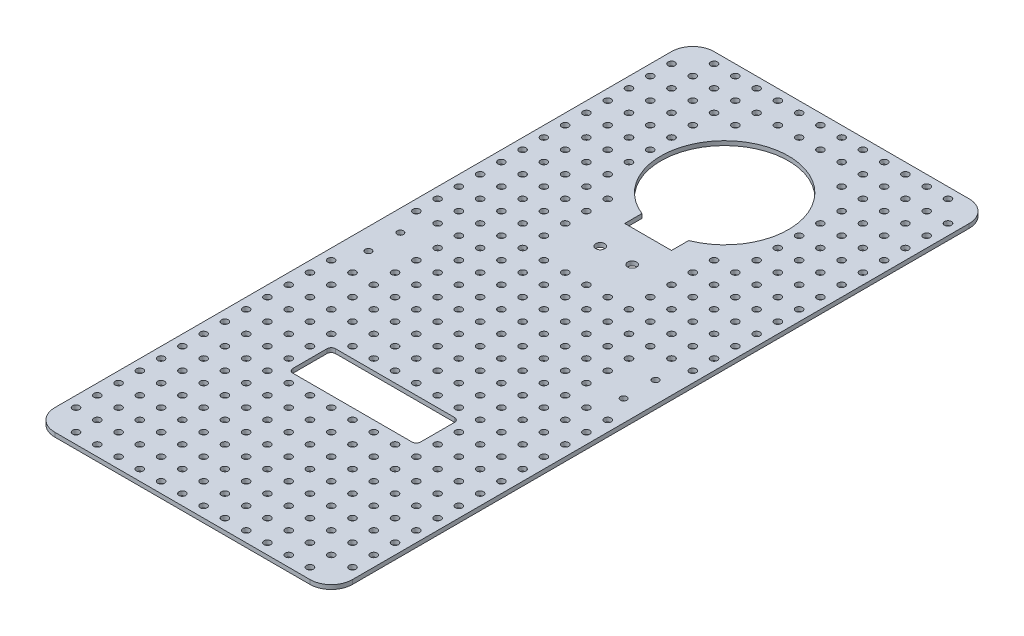
from build123d import *

# Parameters (mm, degrees)
SKETCH_1_W             = 140
SKETCH_1_H             = 310
EXTRUDE_554_DEPTH      = 2
SKETCH_12_R            = 1.5
CUT_EXTRUDE_1045_DEPTH = 171.085272731
SKETCH_11_W            = 60
SKETCH_11_H            = 20
CUT_EXTRUDE_2174_DEPTH = 171.085272731
FILLET_3_R             = 2
SKETCH_18_R            = 2.1
CUT_EXTRUDE_8002_DEPTH = 171.085272731
FILLET_9_R             = 10
SKETCH_20_R            = 1.6
CUT_EXTRUDE_10_DEPTH   = 2


with BuildPart() as part:
    # Эскиз1 → Extrude 554 (new body)
    with BuildSketch(Plane(origin=(0, 0, 0), x_dir=(1, 0, 0), z_dir=(0, 1, 0))):
        Rectangle(SKETCH_1_W, SKETCH_1_H)
    extrude(amount=EXTRUDE_554_DEPTH)

    # Эскиз12 → Cut-Extrude 1045 (cut, through all)
    with BuildSketch(Plane(origin=(0, 2, 0), x_dir=(1, 0, 0), z_dir=(0, 1, 0))):
        with Locations(Location((60, 7.5, 0), (0, 0, 270))):
            Circle(SKETCH_12_R)
        with Locations(Location((-60, 7.5, 0), (0, 0, 270))):
            Circle(SKETCH_12_R)
        with Locations(Location((-60, -7.5, 0), (0, 0, 270))):
            Circle(SKETCH_12_R)
        with Locations(Location((60, -7.5, 0), (0, 0, 270))):
            Circle(SKETCH_12_R)
    extrude(amount=-CUT_EXTRUDE_1045_DEPTH, mode=Mode.SUBTRACT)

    # Эскиз11 → Cut-Extrude 2174 (cut, through all)
    with BuildSketch(Plane(origin=(0, 2, 0), x_dir=(1, 0, 0), z_dir=(0, 1, 0))):
        with Locations((0, -65)):
            Rectangle(SKETCH_11_W, SKETCH_11_H)
    extrude(amount=-CUT_EXTRUDE_2174_DEPTH, mode=Mode.SUBTRACT)

    # Скругление3
    fillet_3_edges = [part.edges().sort_by_distance(p)[0] for p in [
        (-30, 1, 75),
        (-30, 1, 55),
        (30, 1, 55),
        (30, 1, 75),
    ]]
    fillet(fillet_3_edges, radius=FILLET_3_R)

    # Эскиз18 → Cut-Extrude 8002 (cut, through all)
    with BuildSketch(Plane(origin=(0, 2, 0), x_dir=(1, 0, 0), z_dir=(0, 1, 0))):
        with Locations(Location((7.5, 49, 0), (0, 0, 270))):
            Circle(SKETCH_18_R)
        with Locations(Location((-7.5, 49, 0), (0, 0, 270))):
            Circle(SKETCH_18_R)
        with BuildLine():
            Line((-11, 64), (11, 64))
            Line((11, 64), (11, 72.089428526))
            ThreePointArc((11, 72.089428526), (0, 130), (-11, 72.089428526))
            Line((-11, 72.089428526), (-11, 64))
        make_face()
    extrude(amount=-CUT_EXTRUDE_8002_DEPTH, mode=Mode.SUBTRACT)

    # Скругление9
    fillet_9_edges = [part.edges().sort_by_distance(p)[0] for p in [
        (-70, 1, -155),
        (70, 1, -155),
        (70, 1, 155),
        (-70, 1, 155),
    ]]
    fillet(fillet_9_edges, radius=FILLET_9_R)

    # Эскиз20 → Сетка 10мм (cut)
    with BuildSketch(Plane.XZ):
        with Locations(Location((-5, 150, 0), (0, 0, 270))):
            Circle(SKETCH_20_R)
        with Locations(Location((5, 150, 0), (0, 0, 270))):
            Circle(SKETCH_20_R)
        with Locations(Location((15, 150, 0), (0, 0, 270))):
            Circle(SKETCH_20_R)
        with Locations(Location((25, 150, 0), (0, 0, 270))):
            Circle(SKETCH_20_R)
        with Locations(Location((35, 150, 0), (0, 0, 270))):
            Circle(SKETCH_20_R)
        with Locations(Location((45, 150, 0), (0, 0, 270))):
            Circle(SKETCH_20_R)
        with Locations(Location((55, 150, 0), (0, 0, 270))):
            Circle(SKETCH_20_R)
        with Locations(Location((-15, 150, 0), (0, 0, 270))):
            Circle(SKETCH_20_R)
        with Locations(Location((-25, 150, 0), (0, 0, 270))):
            Circle(SKETCH_20_R)
        with Locations(Location((-35, 150, 0), (0, 0, 270))):
            Circle(SKETCH_20_R)
        with Locations(Location((-45, 150, 0), (0, 0, 270))):
            Circle(SKETCH_20_R)
        with Locations(Location((-55, 150, 0), (0, 0, 270))):
            Circle(SKETCH_20_R)
        with Locations(Location((-5, 140, 0), (0, 0, 270))):
            Circle(SKETCH_20_R)
        with Locations(Location((5, 140, 0), (0, 0, 270))):
            Circle(SKETCH_20_R)
        with Locations(Location((15, 140, 0), (0, 0, 270))):
            Circle(SKETCH_20_R)
        with Locations(Location((25, 140, 0), (0, 0, 270))):
            Circle(SKETCH_20_R)
        with Locations(Location((35, 140, 0), (0, 0, 270))):
            Circle(SKETCH_20_R)
        with Locations(Location((45, 140, 0), (0, 0, 270))):
            Circle(SKETCH_20_R)
        with Locations(Location((55, 140, 0), (0, 0, 270))):
            Circle(SKETCH_20_R)
        with Locations(Location((-15, 140, 0), (0, 0, 270))):
            Circle(SKETCH_20_R)
        with Locations(Location((-25, 140, 0), (0, 0, 270))):
            Circle(SKETCH_20_R)
        with Locations(Location((-35, 140, 0), (0, 0, 270))):
            Circle(SKETCH_20_R)
        with Locations(Location((-45, 140, 0), (0, 0, 270))):
            Circle(SKETCH_20_R)
        with Locations(Location((-55, 140, 0), (0, 0, 270))):
            Circle(SKETCH_20_R)
        with Locations(Location((-5, 130, 0), (0, 0, 270))):
            Circle(SKETCH_20_R)
        with Locations(Location((5, 130, 0), (0, 0, 270))):
            Circle(SKETCH_20_R)
        with Locations(Location((15, 130, 0), (0, 0, 270))):
            Circle(SKETCH_20_R)
        with Locations(Location((25, 130, 0), (0, 0, 270))):
            Circle(SKETCH_20_R)
        with Locations(Location((35, 130, 0), (0, 0, 270))):
            Circle(SKETCH_20_R)
        with Locations(Location((45, 130, 0), (0, 0, 270))):
            Circle(SKETCH_20_R)
        with Locations(Location((55, 130, 0), (0, 0, 270))):
            Circle(SKETCH_20_R)
        with Locations(Location((-15, 130, 0), (0, 0, 270))):
            Circle(SKETCH_20_R)
        with Locations(Location((-25, 130, 0), (0, 0, 270))):
            Circle(SKETCH_20_R)
        with Locations(Location((-35, 130, 0), (0, 0, 270))):
            Circle(SKETCH_20_R)
        with Locations(Location((-45, 130, 0), (0, 0, 270))):
            Circle(SKETCH_20_R)
        with Locations(Location((-55, 130, 0), (0, 0, 270))):
            Circle(SKETCH_20_R)
        with Locations(Location((-5, 120, 0), (0, 0, 270))):
            Circle(SKETCH_20_R)
        with Locations(Location((5, 120, 0), (0, 0, 270))):
            Circle(SKETCH_20_R)
        with Locations(Location((15, 120, 0), (0, 0, 270))):
            Circle(SKETCH_20_R)
        with Locations(Location((25, 120, 0), (0, 0, 270))):
            Circle(SKETCH_20_R)
        with Locations(Location((35, 120, 0), (0, 0, 270))):
            Circle(SKETCH_20_R)
        with Locations(Location((45, 120, 0), (0, 0, 270))):
            Circle(SKETCH_20_R)
        with Locations(Location((55, 120, 0), (0, 0, 270))):
            Circle(SKETCH_20_R)
        with Locations(Location((-15, 120, 0), (0, 0, 270))):
            Circle(SKETCH_20_R)
        with Locations(Location((-25, 120, 0), (0, 0, 270))):
            Circle(SKETCH_20_R)
        with Locations(Location((-35, 120, 0), (0, 0, 270))):
            Circle(SKETCH_20_R)
        with Locations(Location((-45, 120, 0), (0, 0, 270))):
            Circle(SKETCH_20_R)
        with Locations(Location((-55, 120, 0), (0, 0, 270))):
            Circle(SKETCH_20_R)
        with Locations(Location((-5, 110, 0), (0, 0, 270))):
            Circle(SKETCH_20_R)
        with Locations(Location((5, 110, 0), (0, 0, 270))):
            Circle(SKETCH_20_R)
        with Locations(Location((15, 110, 0), (0, 0, 270))):
            Circle(SKETCH_20_R)
        with Locations(Location((25, 110, 0), (0, 0, 270))):
            Circle(SKETCH_20_R)
        with Locations(Location((35, 110, 0), (0, 0, 270))):
            Circle(SKETCH_20_R)
        with Locations(Location((45, 110, 0), (0, 0, 270))):
            Circle(SKETCH_20_R)
        with Locations(Location((55, 110, 0), (0, 0, 270))):
            Circle(SKETCH_20_R)
        with Locations(Location((-15, 110, 0), (0, 0, 270))):
            Circle(SKETCH_20_R)
        with Locations(Location((-25, 110, 0), (0, 0, 270))):
            Circle(SKETCH_20_R)
        with Locations(Location((-35, 110, 0), (0, 0, 270))):
            Circle(SKETCH_20_R)
        with Locations(Location((-45, 110, 0), (0, 0, 270))):
            Circle(SKETCH_20_R)
        with Locations(Location((-55, 110, 0), (0, 0, 270))):
            Circle(SKETCH_20_R)
        with Locations(Location((-5, 100, 0), (0, 0, 270))):
            Circle(SKETCH_20_R)
        with Locations(Location((5, 100, 0), (0, 0, 270))):
            Circle(SKETCH_20_R)
        with Locations(Location((15, 100, 0), (0, 0, 270))):
            Circle(SKETCH_20_R)
        with Locations(Location((25, 100, 0), (0, 0, 270))):
            Circle(SKETCH_20_R)
        with Locations(Location((35, 100, 0), (0, 0, 270))):
            Circle(SKETCH_20_R)
        with Locations(Location((45, 100, 0), (0, 0, 270))):
            Circle(SKETCH_20_R)
        with Locations(Location((55, 100, 0), (0, 0, 270))):
            Circle(SKETCH_20_R)
        with Locations(Location((-15, 100, 0), (0, 0, 270))):
            Circle(SKETCH_20_R)
        with Locations(Location((-25, 100, 0), (0, 0, 270))):
            Circle(SKETCH_20_R)
        with Locations(Location((-35, 100, 0), (0, 0, 270))):
            Circle(SKETCH_20_R)
        with Locations(Location((-45, 100, 0), (0, 0, 270))):
            Circle(SKETCH_20_R)
        with Locations(Location((-55, 100, 0), (0, 0, 270))):
            Circle(SKETCH_20_R)
        with Locations(Location((-5, 90, 0), (0, 0, 270))):
            Circle(SKETCH_20_R)
        with Locations(Location((5, 90, 0), (0, 0, 270))):
            Circle(SKETCH_20_R)
        with Locations(Location((15, 90, 0), (0, 0, 270))):
            Circle(SKETCH_20_R)
        with Locations(Location((25, 90, 0), (0, 0, 270))):
            Circle(SKETCH_20_R)
        with Locations(Location((35, 90, 0), (0, 0, 270))):
            Circle(SKETCH_20_R)
        with Locations(Location((45, 90, 0), (0, 0, 270))):
            Circle(SKETCH_20_R)
        with Locations(Location((55, 90, 0), (0, 0, 270))):
            Circle(SKETCH_20_R)
        with Locations(Location((-15, 90, 0), (0, 0, 270))):
            Circle(SKETCH_20_R)
        with Locations(Location((-25, 90, 0), (0, 0, 270))):
            Circle(SKETCH_20_R)
        with Locations(Location((-35, 90, 0), (0, 0, 270))):
            Circle(SKETCH_20_R)
        with Locations(Location((-45, 90, 0), (0, 0, 270))):
            Circle(SKETCH_20_R)
        with Locations(Location((-55, 90, 0), (0, 0, 270))):
            Circle(SKETCH_20_R)
        with Locations(Location((-5, 80, 0), (0, 0, 270))):
            Circle(SKETCH_20_R)
        with Locations(Location((5, 80, 0), (0, 0, 270))):
            Circle(SKETCH_20_R)
        with Locations(Location((15, 80, 0), (0, 0, 270))):
            Circle(SKETCH_20_R)
        with Locations(Location((25, 80, 0), (0, 0, 270))):
            Circle(SKETCH_20_R)
        with Locations(Location((35, 80, 0), (0, 0, 270))):
            Circle(SKETCH_20_R)
        with Locations(Location((45, 80, 0), (0, 0, 270))):
            Circle(SKETCH_20_R)
        with Locations(Location((55, 80, 0), (0, 0, 270))):
            Circle(SKETCH_20_R)
        with Locations(Location((-15, 80, 0), (0, 0, 270))):
            Circle(SKETCH_20_R)
        with Locations(Location((-25, 80, 0), (0, 0, 270))):
            Circle(SKETCH_20_R)
        with Locations(Location((-35, 80, 0), (0, 0, 270))):
            Circle(SKETCH_20_R)
        with Locations(Location((-45, 80, 0), (0, 0, 270))):
            Circle(SKETCH_20_R)
        with Locations(Location((-55, 80, 0), (0, 0, 270))):
            Circle(SKETCH_20_R)
        with Locations(Location((35, 70, 0), (0, 0, 270))):
            Circle(SKETCH_20_R)
        with Locations(Location((45, 70, 0), (0, 0, 270))):
            Circle(SKETCH_20_R)
        with Locations(Location((55, 70, 0), (0, 0, 270))):
            Circle(SKETCH_20_R)
        with Locations(Location((-35, 70, 0), (0, 0, 270))):
            Circle(SKETCH_20_R)
        with Locations(Location((-45, 70, 0), (0, 0, 270))):
            Circle(SKETCH_20_R)
        with Locations(Location((-55, 70, 0), (0, 0, 270))):
            Circle(SKETCH_20_R)
        with Locations(Location((35, 60, 0), (0, 0, 270))):
            Circle(SKETCH_20_R)
        with Locations(Location((45, 60, 0), (0, 0, 270))):
            Circle(SKETCH_20_R)
        with Locations(Location((55, 60, 0), (0, 0, 270))):
            Circle(SKETCH_20_R)
        with Locations(Location((-35, 60, 0), (0, 0, 270))):
            Circle(SKETCH_20_R)
        with Locations(Location((-45, 60, 0), (0, 0, 270))):
            Circle(SKETCH_20_R)
        with Locations(Location((-55, 60, 0), (0, 0, 270))):
            Circle(SKETCH_20_R)
        with Locations(Location((-5, 50, 0), (0, 0, 270))):
            Circle(SKETCH_20_R)
        with Locations(Location((5, 50, 0), (0, 0, 270))):
            Circle(SKETCH_20_R)
        with Locations(Location((15, 50, 0), (0, 0, 270))):
            Circle(SKETCH_20_R)
        with Locations(Location((25, 50, 0), (0, 0, 270))):
            Circle(SKETCH_20_R)
        with Locations(Location((35, 50, 0), (0, 0, 270))):
            Circle(SKETCH_20_R)
        with Locations(Location((45, 50, 0), (0, 0, 270))):
            Circle(SKETCH_20_R)
        with Locations(Location((55, 50, 0), (0, 0, 270))):
            Circle(SKETCH_20_R)
        with Locations(Location((-15, 50, 0), (0, 0, 270))):
            Circle(SKETCH_20_R)
        with Locations(Location((-25, 50, 0), (0, 0, 270))):
            Circle(SKETCH_20_R)
        with Locations(Location((-35, 50, 0), (0, 0, 270))):
            Circle(SKETCH_20_R)
        with Locations(Location((-45, 50, 0), (0, 0, 270))):
            Circle(SKETCH_20_R)
        with Locations(Location((-55, 50, 0), (0, 0, 270))):
            Circle(SKETCH_20_R)
        with Locations(Location((-5, 40, 0), (0, 0, 270))):
            Circle(SKETCH_20_R)
        with Locations(Location((5, 40, 0), (0, 0, 270))):
            Circle(SKETCH_20_R)
        with Locations(Location((15, 40, 0), (0, 0, 270))):
            Circle(SKETCH_20_R)
        with Locations(Location((25, 40, 0), (0, 0, 270))):
            Circle(SKETCH_20_R)
        with Locations(Location((35, 40, 0), (0, 0, 270))):
            Circle(SKETCH_20_R)
        with Locations(Location((45, 40, 0), (0, 0, 270))):
            Circle(SKETCH_20_R)
        with Locations(Location((55, 40, 0), (0, 0, 270))):
            Circle(SKETCH_20_R)
        with Locations(Location((-15, 40, 0), (0, 0, 270))):
            Circle(SKETCH_20_R)
        with Locations(Location((-25, 40, 0), (0, 0, 270))):
            Circle(SKETCH_20_R)
        with Locations(Location((-35, 40, 0), (0, 0, 270))):
            Circle(SKETCH_20_R)
        with Locations(Location((-45, 40, 0), (0, 0, 270))):
            Circle(SKETCH_20_R)
        with Locations(Location((-55, 40, 0), (0, 0, 270))):
            Circle(SKETCH_20_R)
        with Locations(Location((-5, 30, 0), (0, 0, 270))):
            Circle(SKETCH_20_R)
        with Locations(Location((5, 30, 0), (0, 0, 270))):
            Circle(SKETCH_20_R)
        with Locations(Location((15, 30, 0), (0, 0, 270))):
            Circle(SKETCH_20_R)
        with Locations(Location((25, 30, 0), (0, 0, 270))):
            Circle(SKETCH_20_R)
        with Locations(Location((35, 30, 0), (0, 0, 270))):
            Circle(SKETCH_20_R)
        with Locations(Location((45, 30, 0), (0, 0, 270))):
            Circle(SKETCH_20_R)
        with Locations(Location((55, 30, 0), (0, 0, 270))):
            Circle(SKETCH_20_R)
        with Locations(Location((-15, 30, 0), (0, 0, 270))):
            Circle(SKETCH_20_R)
        with Locations(Location((-25, 30, 0), (0, 0, 270))):
            Circle(SKETCH_20_R)
        with Locations(Location((-35, 30, 0), (0, 0, 270))):
            Circle(SKETCH_20_R)
        with Locations(Location((-45, 30, 0), (0, 0, 270))):
            Circle(SKETCH_20_R)
        with Locations(Location((-55, 30, 0), (0, 0, 270))):
            Circle(SKETCH_20_R)
        with Locations(Location((-5, 20, 0), (0, 0, 270))):
            Circle(SKETCH_20_R)
        with Locations(Location((5, 20, 0), (0, 0, 270))):
            Circle(SKETCH_20_R)
        with Locations(Location((15, 20, 0), (0, 0, 270))):
            Circle(SKETCH_20_R)
        with Locations(Location((25, 20, 0), (0, 0, 270))):
            Circle(SKETCH_20_R)
        with Locations(Location((35, 20, 0), (0, 0, 270))):
            Circle(SKETCH_20_R)
        with Locations(Location((45, 20, 0), (0, 0, 270))):
            Circle(SKETCH_20_R)
        with Locations(Location((55, 20, 0), (0, 0, 270))):
            Circle(SKETCH_20_R)
        with Locations(Location((-15, 20, 0), (0, 0, 270))):
            Circle(SKETCH_20_R)
        with Locations(Location((-25, 20, 0), (0, 0, 270))):
            Circle(SKETCH_20_R)
        with Locations(Location((-35, 20, 0), (0, 0, 270))):
            Circle(SKETCH_20_R)
        with Locations(Location((-45, 20, 0), (0, 0, 270))):
            Circle(SKETCH_20_R)
        with Locations(Location((-55, 20, 0), (0, 0, 270))):
            Circle(SKETCH_20_R)
        with Locations(Location((-5, 10, 0), (0, 0, 270))):
            Circle(SKETCH_20_R)
        with Locations(Location((5, 10, 0), (0, 0, 270))):
            Circle(SKETCH_20_R)
        with Locations(Location((15, 10, 0), (0, 0, 270))):
            Circle(SKETCH_20_R)
        with Locations(Location((25, 10, 0), (0, 0, 270))):
            Circle(SKETCH_20_R)
        with Locations(Location((35, 10, 0), (0, 0, 270))):
            Circle(SKETCH_20_R)
        with Locations(Location((45, 10, 0), (0, 0, 270))):
            Circle(SKETCH_20_R)
        with Locations(Location((-15, 10, 0), (0, 0, 270))):
            Circle(SKETCH_20_R)
        with Locations(Location((-25, 10, 0), (0, 0, 270))):
            Circle(SKETCH_20_R)
        with Locations(Location((-35, 10, 0), (0, 0, 270))):
            Circle(SKETCH_20_R)
        with Locations(Location((-45, 10, 0), (0, 0, 270))):
            Circle(SKETCH_20_R)
        with Locations(Location((-5, 0, 0), (0, 0, 270))):
            Circle(SKETCH_20_R)
        with Locations(Location((5, 0, 0), (0, 0, 270))):
            Circle(SKETCH_20_R)
        with Locations(Location((15, 0, 0), (0, 0, 270))):
            Circle(SKETCH_20_R)
        with Locations(Location((25, 0, 0), (0, 0, 270))):
            Circle(SKETCH_20_R)
        with Locations(Location((35, 0, 0), (0, 0, 270))):
            Circle(SKETCH_20_R)
        with Locations(Location((45, 0, 0), (0, 0, 270))):
            Circle(SKETCH_20_R)
        with Locations(Location((-15, 0, 0), (0, 0, 270))):
            Circle(SKETCH_20_R)
        with Locations(Location((-25, 0, 0), (0, 0, 270))):
            Circle(SKETCH_20_R)
        with Locations(Location((-35, 0, 0), (0, 0, 270))):
            Circle(SKETCH_20_R)
        with Locations(Location((-45, 0, 0), (0, 0, 270))):
            Circle(SKETCH_20_R)
        with Locations(Location((-5, -10, 0), (0, 0, 270))):
            Circle(SKETCH_20_R)
        with Locations(Location((5, -10, 0), (0, 0, 270))):
            Circle(SKETCH_20_R)
        with Locations(Location((15, -10, 0), (0, 0, 270))):
            Circle(SKETCH_20_R)
        with Locations(Location((25, -10, 0), (0, 0, 270))):
            Circle(SKETCH_20_R)
        with Locations(Location((35, -10, 0), (0, 0, 270))):
            Circle(SKETCH_20_R)
        with Locations(Location((45, -10, 0), (0, 0, 270))):
            Circle(SKETCH_20_R)
        with Locations(Location((-15, -10, 0), (0, 0, 270))):
            Circle(SKETCH_20_R)
        with Locations(Location((-25, -10, 0), (0, 0, 270))):
            Circle(SKETCH_20_R)
        with Locations(Location((-35, -10, 0), (0, 0, 270))):
            Circle(SKETCH_20_R)
        with Locations(Location((-45, -10, 0), (0, 0, 270))):
            Circle(SKETCH_20_R)
        with Locations(Location((-5, -20, 0), (0, 0, 270))):
            Circle(SKETCH_20_R)
        with Locations(Location((5, -20, 0), (0, 0, 270))):
            Circle(SKETCH_20_R)
        with Locations(Location((15, -20, 0), (0, 0, 270))):
            Circle(SKETCH_20_R)
        with Locations(Location((25, -20, 0), (0, 0, 270))):
            Circle(SKETCH_20_R)
        with Locations(Location((35, -20, 0), (0, 0, 270))):
            Circle(SKETCH_20_R)
        with Locations(Location((45, -20, 0), (0, 0, 270))):
            Circle(SKETCH_20_R)
        with Locations(Location((55, -20, 0), (0, 0, 270))):
            Circle(SKETCH_20_R)
        with Locations(Location((-15, -20, 0), (0, 0, 270))):
            Circle(SKETCH_20_R)
        with Locations(Location((-25, -20, 0), (0, 0, 270))):
            Circle(SKETCH_20_R)
        with Locations(Location((-35, -20, 0), (0, 0, 270))):
            Circle(SKETCH_20_R)
        with Locations(Location((-45, -20, 0), (0, 0, 270))):
            Circle(SKETCH_20_R)
        with Locations(Location((-55, -20, 0), (0, 0, 270))):
            Circle(SKETCH_20_R)
        with Locations(Location((-5, -30, 0), (0, 0, 270))):
            Circle(SKETCH_20_R)
        with Locations(Location((5, -30, 0), (0, 0, 270))):
            Circle(SKETCH_20_R)
        with Locations(Location((15, -30, 0), (0, 0, 270))):
            Circle(SKETCH_20_R)
        with Locations(Location((25, -30, 0), (0, 0, 270))):
            Circle(SKETCH_20_R)
        with Locations(Location((35, -30, 0), (0, 0, 270))):
            Circle(SKETCH_20_R)
        with Locations(Location((45, -30, 0), (0, 0, 270))):
            Circle(SKETCH_20_R)
        with Locations(Location((55, -30, 0), (0, 0, 270))):
            Circle(SKETCH_20_R)
        with Locations(Location((-15, -30, 0), (0, 0, 270))):
            Circle(SKETCH_20_R)
        with Locations(Location((-25, -30, 0), (0, 0, 270))):
            Circle(SKETCH_20_R)
        with Locations(Location((-35, -30, 0), (0, 0, 270))):
            Circle(SKETCH_20_R)
        with Locations(Location((-45, -30, 0), (0, 0, 270))):
            Circle(SKETCH_20_R)
        with Locations(Location((-55, -30, 0), (0, 0, 270))):
            Circle(SKETCH_20_R)
        with Locations(Location((25, -40, 0), (0, 0, 270))):
            Circle(SKETCH_20_R)
        with Locations(Location((35, -40, 0), (0, 0, 270))):
            Circle(SKETCH_20_R)
        with Locations(Location((45, -40, 0), (0, 0, 270))):
            Circle(SKETCH_20_R)
        with Locations(Location((55, -40, 0), (0, 0, 270))):
            Circle(SKETCH_20_R)
        with Locations(Location((-25, -40, 0), (0, 0, 270))):
            Circle(SKETCH_20_R)
        with Locations(Location((-35, -40, 0), (0, 0, 270))):
            Circle(SKETCH_20_R)
        with Locations(Location((-45, -40, 0), (0, 0, 270))):
            Circle(SKETCH_20_R)
        with Locations(Location((-55, -40, 0), (0, 0, 270))):
            Circle(SKETCH_20_R)
        with Locations(Location((25, -50, 0), (0, 0, 270))):
            Circle(SKETCH_20_R)
        with Locations(Location((35, -50, 0), (0, 0, 270))):
            Circle(SKETCH_20_R)
        with Locations(Location((45, -50, 0), (0, 0, 270))):
            Circle(SKETCH_20_R)
        with Locations(Location((55, -50, 0), (0, 0, 270))):
            Circle(SKETCH_20_R)
        with Locations(Location((-25, -50, 0), (0, 0, 270))):
            Circle(SKETCH_20_R)
        with Locations(Location((-35, -50, 0), (0, 0, 270))):
            Circle(SKETCH_20_R)
        with Locations(Location((-45, -50, 0), (0, 0, 270))):
            Circle(SKETCH_20_R)
        with Locations(Location((-55, -50, 0), (0, 0, 270))):
            Circle(SKETCH_20_R)
        with Locations(Location((25, -60, 0), (0, 0, 270))):
            Circle(SKETCH_20_R)
        with Locations(Location((35, -60, 0), (0, 0, 270))):
            Circle(SKETCH_20_R)
        with Locations(Location((45, -60, 0), (0, 0, 270))):
            Circle(SKETCH_20_R)
        with Locations(Location((55, -60, 0), (0, 0, 270))):
            Circle(SKETCH_20_R)
        with Locations(Location((-25, -60, 0), (0, 0, 270))):
            Circle(SKETCH_20_R)
        with Locations(Location((-35, -60, 0), (0, 0, 270))):
            Circle(SKETCH_20_R)
        with Locations(Location((-45, -60, 0), (0, 0, 270))):
            Circle(SKETCH_20_R)
        with Locations(Location((-55, -60, 0), (0, 0, 270))):
            Circle(SKETCH_20_R)
        with Locations(Location((25, -70, 0), (0, 0, 270))):
            Circle(SKETCH_20_R)
        with Locations(Location((35, -70, 0), (0, 0, 270))):
            Circle(SKETCH_20_R)
        with Locations(Location((45, -70, 0), (0, 0, 270))):
            Circle(SKETCH_20_R)
        with Locations(Location((55, -70, 0), (0, 0, 270))):
            Circle(SKETCH_20_R)
        with Locations(Location((-25, -70, 0), (0, 0, 270))):
            Circle(SKETCH_20_R)
        with Locations(Location((-35, -70, 0), (0, 0, 270))):
            Circle(SKETCH_20_R)
        with Locations(Location((-45, -70, 0), (0, 0, 270))):
            Circle(SKETCH_20_R)
        with Locations(Location((-55, -70, 0), (0, 0, 270))):
            Circle(SKETCH_20_R)
        with Locations(Location((35, -80, 0), (0, 0, 270))):
            Circle(SKETCH_20_R)
        with Locations(Location((45, -80, 0), (0, 0, 270))):
            Circle(SKETCH_20_R)
        with Locations(Location((55, -80, 0), (0, 0, 270))):
            Circle(SKETCH_20_R)
        with Locations(Location((-35, -80, 0), (0, 0, 270))):
            Circle(SKETCH_20_R)
        with Locations(Location((-45, -80, 0), (0, 0, 270))):
            Circle(SKETCH_20_R)
        with Locations(Location((-55, -80, 0), (0, 0, 270))):
            Circle(SKETCH_20_R)
        with Locations(Location((35, -90, 0), (0, 0, 270))):
            Circle(SKETCH_20_R)
        with Locations(Location((45, -90, 0), (0, 0, 270))):
            Circle(SKETCH_20_R)
        with Locations(Location((55, -90, 0), (0, 0, 270))):
            Circle(SKETCH_20_R)
        with Locations(Location((-35, -90, 0), (0, 0, 270))):
            Circle(SKETCH_20_R)
        with Locations(Location((-45, -90, 0), (0, 0, 270))):
            Circle(SKETCH_20_R)
        with Locations(Location((-55, -90, 0), (0, 0, 270))):
            Circle(SKETCH_20_R)
        with Locations(Location((35, -100, 0), (0, 0, 270))):
            Circle(SKETCH_20_R)
        with Locations(Location((45, -100, 0), (0, 0, 270))):
            Circle(SKETCH_20_R)
        with Locations(Location((55, -100, 0), (0, 0, 270))):
            Circle(SKETCH_20_R)
        with Locations(Location((-35, -100, 0), (0, 0, 270))):
            Circle(SKETCH_20_R)
        with Locations(Location((-45, -100, 0), (0, 0, 270))):
            Circle(SKETCH_20_R)
        with Locations(Location((-55, -100, 0), (0, 0, 270))):
            Circle(SKETCH_20_R)
        with Locations(Location((35, -110, 0), (0, 0, 270))):
            Circle(SKETCH_20_R)
        with Locations(Location((45, -110, 0), (0, 0, 270))):
            Circle(SKETCH_20_R)
        with Locations(Location((55, -110, 0), (0, 0, 270))):
            Circle(SKETCH_20_R)
        with Locations(Location((-35, -110, 0), (0, 0, 270))):
            Circle(SKETCH_20_R)
        with Locations(Location((-45, -110, 0), (0, 0, 270))):
            Circle(SKETCH_20_R)
        with Locations(Location((-55, -110, 0), (0, 0, 270))):
            Circle(SKETCH_20_R)
        with Locations(Location((35, -120, 0), (0, 0, 270))):
            Circle(SKETCH_20_R)
        with Locations(Location((45, -120, 0), (0, 0, 270))):
            Circle(SKETCH_20_R)
        with Locations(Location((55, -120, 0), (0, 0, 270))):
            Circle(SKETCH_20_R)
        with Locations(Location((-35, -120, 0), (0, 0, 270))):
            Circle(SKETCH_20_R)
        with Locations(Location((-45, -120, 0), (0, 0, 270))):
            Circle(SKETCH_20_R)
        with Locations(Location((-55, -120, 0), (0, 0, 270))):
            Circle(SKETCH_20_R)
        with Locations(Location((25, -130, 0), (0, 0, 270))):
            Circle(SKETCH_20_R)
        with Locations(Location((35, -130, 0), (0, 0, 270))):
            Circle(SKETCH_20_R)
        with Locations(Location((45, -130, 0), (0, 0, 270))):
            Circle(SKETCH_20_R)
        with Locations(Location((55, -130, 0), (0, 0, 270))):
            Circle(SKETCH_20_R)
        with Locations(Location((-25, -130, 0), (0, 0, 270))):
            Circle(SKETCH_20_R)
        with Locations(Location((-35, -130, 0), (0, 0, 270))):
            Circle(SKETCH_20_R)
        with Locations(Location((-45, -130, 0), (0, 0, 270))):
            Circle(SKETCH_20_R)
        with Locations(Location((-55, -130, 0), (0, 0, 270))):
            Circle(SKETCH_20_R)
        with Locations(Location((-5, -140, 0), (0, 0, 270))):
            Circle(SKETCH_20_R)
        with Locations(Location((5, -140, 0), (0, 0, 270))):
            Circle(SKETCH_20_R)
        with Locations(Location((15, -140, 0), (0, 0, 270))):
            Circle(SKETCH_20_R)
        with Locations(Location((25, -140, 0), (0, 0, 270))):
            Circle(SKETCH_20_R)
        with Locations(Location((35, -140, 0), (0, 0, 270))):
            Circle(SKETCH_20_R)
        with Locations(Location((45, -140, 0), (0, 0, 270))):
            Circle(SKETCH_20_R)
        with Locations(Location((55, -140, 0), (0, 0, 270))):
            Circle(SKETCH_20_R)
        with Locations(Location((-15, -140, 0), (0, 0, 270))):
            Circle(SKETCH_20_R)
        with Locations(Location((-25, -140, 0), (0, 0, 270))):
            Circle(SKETCH_20_R)
        with Locations(Location((-35, -140, 0), (0, 0, 270))):
            Circle(SKETCH_20_R)
        with Locations(Location((-45, -140, 0), (0, 0, 270))):
            Circle(SKETCH_20_R)
        with Locations(Location((-55, -140, 0), (0, 0, 270))):
            Circle(SKETCH_20_R)
        with Locations(Location((-5, -150, 0), (0, 0, 270))):
            Circle(SKETCH_20_R)
        with Locations(Location((5, -150, 0), (0, 0, 270))):
            Circle(SKETCH_20_R)
        with Locations(Location((15, -150, 0), (0, 0, 270))):
            Circle(SKETCH_20_R)
        with Locations(Location((25, -150, 0), (0, 0, 270))):
            Circle(SKETCH_20_R)
        with Locations(Location((35, -150, 0), (0, 0, 270))):
            Circle(SKETCH_20_R)
        with Locations(Location((45, -150, 0), (0, 0, 270))):
            Circle(SKETCH_20_R)
        with Locations(Location((55, -150, 0), (0, 0, 270))):
            Circle(SKETCH_20_R)
        with Locations(Location((-15, -150, 0), (0, 0, 270))):
            Circle(SKETCH_20_R)
        with Locations(Location((-25, -150, 0), (0, 0, 270))):
            Circle(SKETCH_20_R)
        with Locations(Location((-35, -150, 0), (0, 0, 270))):
            Circle(SKETCH_20_R)
        with Locations(Location((-45, -150, 0), (0, 0, 270))):
            Circle(SKETCH_20_R)
        with Locations(Location((-55, -150, 0), (0, 0, 270))):
            Circle(SKETCH_20_R)
        with Locations(Location((-65, 140, 0), (0, 0, 270))):
            Circle(SKETCH_20_R)
        with Locations(Location((-65, 130, 0), (0, 0, 270))):
            Circle(SKETCH_20_R)
        with Locations(Location((-65, 120, 0), (0, 0, 270))):
            Circle(SKETCH_20_R)
        with Locations(Location((-65, 110, 0), (0, 0, 270))):
            Circle(SKETCH_20_R)
        with Locations(Location((-65, 100, 0), (0, 0, 270))):
            Circle(SKETCH_20_R)
        with Locations(Location((-65, 90, 0), (0, 0, 270))):
            Circle(SKETCH_20_R)
        with Locations(Location((-65, 80, 0), (0, 0, 270))):
            Circle(SKETCH_20_R)
        with Locations(Location((-65, 70, 0), (0, 0, 270))):
            Circle(SKETCH_20_R)
        with Locations(Location((-65, 60, 0), (0, 0, 270))):
            Circle(SKETCH_20_R)
        with Locations(Location((-65, 50, 0), (0, 0, 270))):
            Circle(SKETCH_20_R)
        with Locations(Location((-65, 40, 0), (0, 0, 270))):
            Circle(SKETCH_20_R)
        with Locations(Location((-65, 30, 0), (0, 0, 270))):
            Circle(SKETCH_20_R)
        with Locations(Location((-65, 20, 0), (0, 0, 270))):
            Circle(SKETCH_20_R)
        with Locations(Location((-65, -20, 0), (0, 0, 270))):
            Circle(SKETCH_20_R)
        with Locations(Location((-65, -30, 0), (0, 0, 270))):
            Circle(SKETCH_20_R)
        with Locations(Location((-65, -40, 0), (0, 0, 270))):
            Circle(SKETCH_20_R)
        with Locations(Location((-65, -50, 0), (0, 0, 270))):
            Circle(SKETCH_20_R)
        with Locations(Location((-65, -60, 0), (0, 0, 270))):
            Circle(SKETCH_20_R)
        with Locations(Location((-65, -70, 0), (0, 0, 270))):
            Circle(SKETCH_20_R)
        with Locations(Location((-65, -80, 0), (0, 0, 270))):
            Circle(SKETCH_20_R)
        with Locations(Location((-65, -90, 0), (0, 0, 270))):
            Circle(SKETCH_20_R)
        with Locations(Location((-65, -100, 0), (0, 0, 270))):
            Circle(SKETCH_20_R)
        with Locations(Location((-65, -110, 0), (0, 0, 270))):
            Circle(SKETCH_20_R)
        with Locations(Location((-65, -120, 0), (0, 0, 270))):
            Circle(SKETCH_20_R)
        with Locations(Location((-65, -130, 0), (0, 0, 270))):
            Circle(SKETCH_20_R)
        with Locations(Location((-65, -140, 0), (0, 0, 270))):
            Circle(SKETCH_20_R)
        with Locations(Location((65, 140, 0), (0, 0, 270))):
            Circle(SKETCH_20_R)
        with Locations(Location((65, 130, 0), (0, 0, 270))):
            Circle(SKETCH_20_R)
        with Locations(Location((65, 120, 0), (0, 0, 270))):
            Circle(SKETCH_20_R)
        with Locations(Location((65, 110, 0), (0, 0, 270))):
            Circle(SKETCH_20_R)
        with Locations(Location((65, 100, 0), (0, 0, 270))):
            Circle(SKETCH_20_R)
        with Locations(Location((65, 90, 0), (0, 0, 270))):
            Circle(SKETCH_20_R)
        with Locations(Location((65, 80, 0), (0, 0, 270))):
            Circle(SKETCH_20_R)
        with Locations(Location((65, 70, 0), (0, 0, 270))):
            Circle(SKETCH_20_R)
        with Locations(Location((65, 60, 0), (0, 0, 270))):
            Circle(SKETCH_20_R)
        with Locations(Location((65, 50, 0), (0, 0, 270))):
            Circle(SKETCH_20_R)
        with Locations(Location((65, 40, 0), (0, 0, 270))):
            Circle(SKETCH_20_R)
        with Locations(Location((65, 30, 0), (0, 0, 270))):
            Circle(SKETCH_20_R)
        with Locations(Location((65, 20, 0), (0, 0, 270))):
            Circle(SKETCH_20_R)
        with Locations(Location((65, -20, 0), (0, 0, 270))):
            Circle(SKETCH_20_R)
        with Locations(Location((65, -30, 0), (0, 0, 270))):
            Circle(SKETCH_20_R)
        with Locations(Location((65, -40, 0), (0, 0, 270))):
            Circle(SKETCH_20_R)
        with Locations(Location((65, -50, 0), (0, 0, 270))):
            Circle(SKETCH_20_R)
        with Locations(Location((65, -60, 0), (0, 0, 270))):
            Circle(SKETCH_20_R)
        with Locations(Location((65, -70, 0), (0, 0, 270))):
            Circle(SKETCH_20_R)
        with Locations(Location((65, -80, 0), (0, 0, 270))):
            Circle(SKETCH_20_R)
        with Locations(Location((65, -90, 0), (0, 0, 270))):
            Circle(SKETCH_20_R)
        with Locations(Location((65, -100, 0), (0, 0, 270))):
            Circle(SKETCH_20_R)
        with Locations(Location((65, -110, 0), (0, 0, 270))):
            Circle(SKETCH_20_R)
        with Locations(Location((65, -120, 0), (0, 0, 270))):
            Circle(SKETCH_20_R)
        with Locations(Location((65, -130, 0), (0, 0, 270))):
            Circle(SKETCH_20_R)
        with Locations(Location((65, -140, 0), (0, 0, 270))):
            Circle(SKETCH_20_R)
    extrude(amount=-CUT_EXTRUDE_10_DEPTH, mode=Mode.SUBTRACT)


solid = part.part
